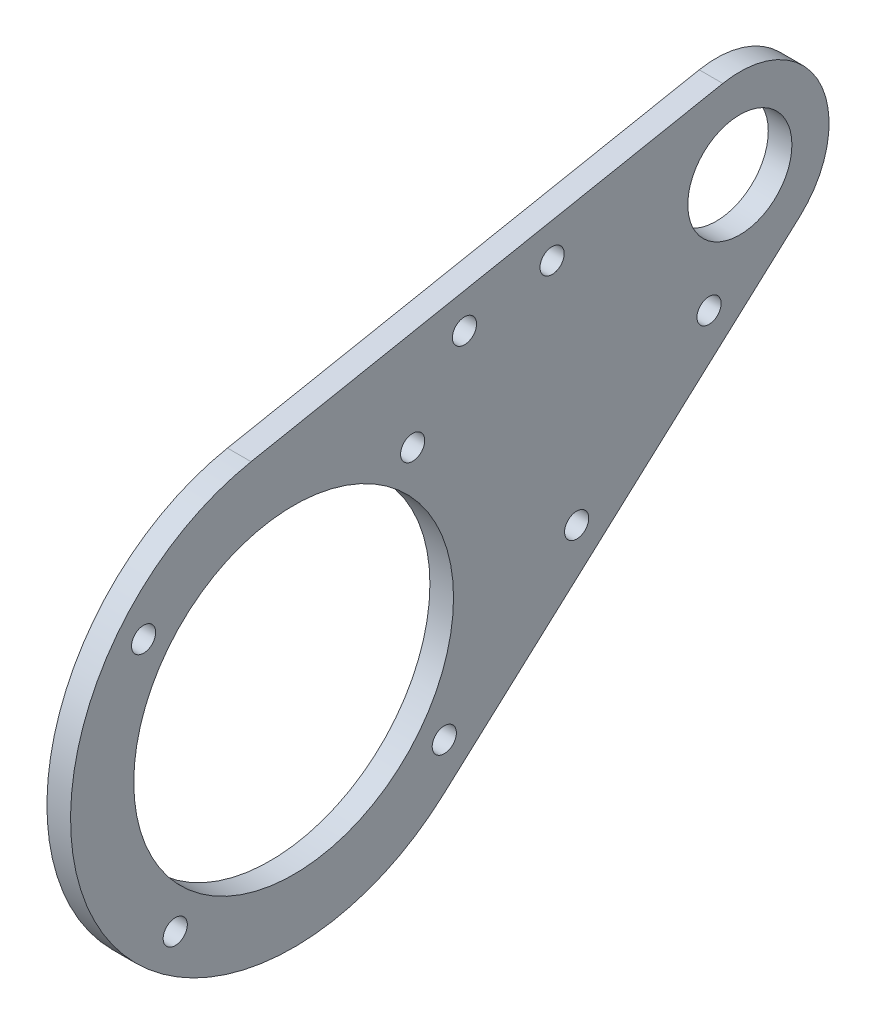
from build123d import *

# Parameters (mm, degrees)
SKETCH1_R           = 21.5
SKETCH1_R_2         = 7
BOSS_EXTRUDE1_DEPTH = 3.175
SKETCH2_R           = 1.625
CUT_EXTRUDE1_DEPTH  = 84.415110292


with BuildPart() as part:
    # Sketch1 → Boss-Extrude1 (new body)
    with BuildSketch(Plane(origin=(0, 0, 0), x_dir=(0, 0, -1), z_dir=(1, 0, 0))):
        with BuildLine():
            Line((-5.724395537, 29.448791074), (57.710241785, 41.77951643))
            ThreePointArc((57.710241785, 41.77951643), (70.733126292, 35.366563146), (68.049758215, 21.10048357))
            Line((68.049758215, 21.10048357), (20.124395537, -22.248791074))
            ThreePointArc((20.124395537, -22.248791074), (-26.83281573, -13.416407865), (-5.724395537, 29.448791074))
        make_face()
        Circle(SKETCH1_R, mode=Mode.SUBTRACT)
        with Locations((60, 30)):
            Circle(SKETCH1_R_2, mode=Mode.SUBTRACT)
    extrude(amount=BOSS_EXTRUDE1_DEPTH)

    # Sketch2 → Cut-Extrude1 (cut, through all)
    with BuildSketch(Plane(origin=(3.175, 0, 0), x_dir=(0, 0, -1), z_dir=(1, 0, 0))):
        with Locations((-20.175789947, 16)):
            Circle(SKETCH2_R)
        with Locations((16.003976299, 20.255101188)):
            Circle(SKETCH2_R)
        with Locations((20.259077487, -15.924665058)):
            Circle(SKETCH2_R)
        with Locations((-15.920688759, -20.179766246)):
            Circle(SKETCH2_R)
        with Locations((38.058110346, 0.174851372)):
            Circle(SKETCH2_R)
        with Locations((55.857143206, 16.274367802)):
            Circle(SKETCH2_R)
        with Locations((22.974747305, 30.341577454)):
            Circle(SKETCH2_R)
        with Locations((34.754263735, 32.631335669)):
            Circle(SKETCH2_R)
    extrude(amount=-CUT_EXTRUDE1_DEPTH, mode=Mode.SUBTRACT)


solid = part.part
